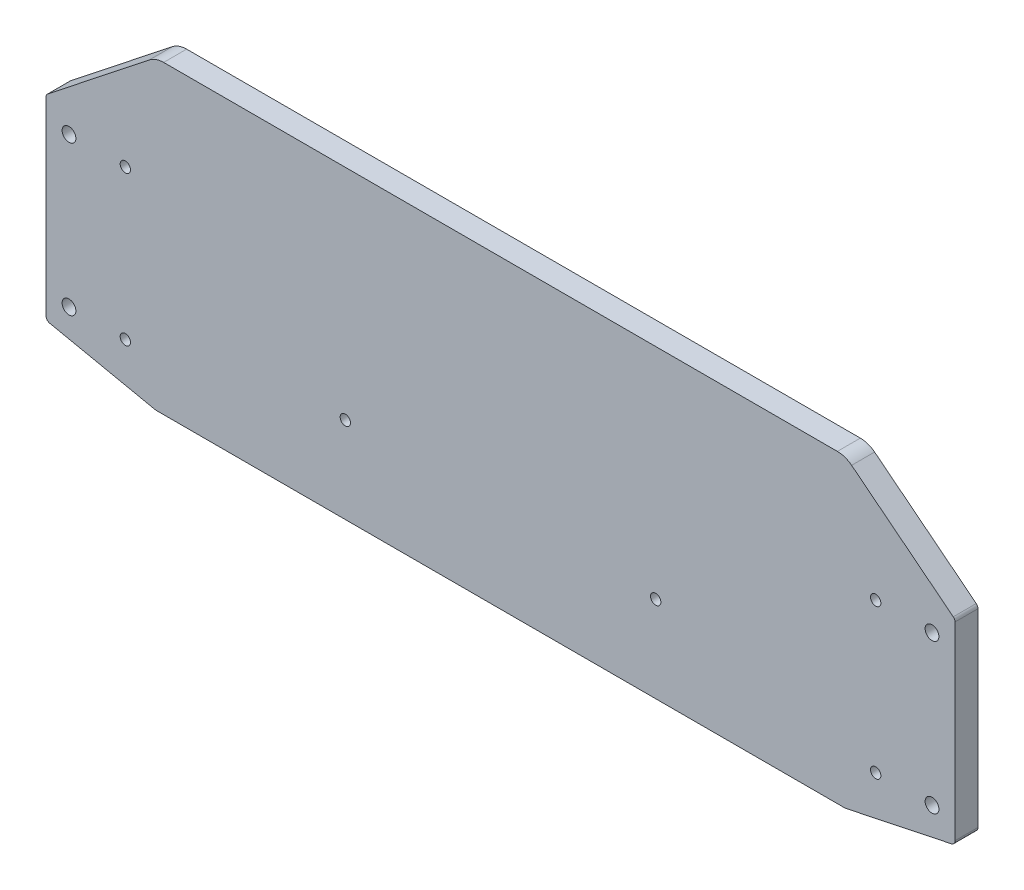
from build123d import *

# Parameters (mm, degrees)
BOSS_EXTRU_1_DEPTH      = 10
ESQUISSE3_R             = 2.25
ESQUISSE3_R_2           = 3
ENL_V_MAT_EXTRU_1_DEPTH = 10
ESQUISSE4_R             = 2.25
ENL_V_MAT_EXTRU_2_DEPTH = 10
CONG_1_R                = 10
CONG_2_R                = 2


with BuildPart() as part:
    # Esquisse1 → Boss.-Extru.1 (new body)
    with BuildSketch(Plane.XY):
        Polygon((-150, 80.2), (-197.7, 42.5), (-197.7, -42.5), (-150, -52.5), (150, -52.5), (197.7, -42.5), (197.7, 42.5), (150, 80.2), align=None)
    extrude(amount=BOSS_EXTRU_1_DEPTH)

    # Esquisse3 → Enlèv. mat.-Extru.1 (cut)
    with BuildSketch(Plane.XY.offset(10)):
        with Locations((-163.2, 32.5)):
            Circle(ESQUISSE3_R)
        with Locations((-187.7, 32.5)):
            Circle(ESQUISSE3_R_2)
        with Locations((-187.7, 57)):
            Circle(ESQUISSE3_R)
        with Locations((-187.7, -32.5)):
            Circle(ESQUISSE3_R_2)
        with Locations((-163.2, -32.5)):
            Circle(ESQUISSE3_R)
        with Locations((187.7, -32.5)):
            Circle(ESQUISSE3_R_2)
        with Locations((163.2, -32.5)):
            Circle(ESQUISSE3_R)
        with Locations((187.7, 32.5)):
            Circle(ESQUISSE3_R_2)
        with Locations((163.2, 32.5)):
            Circle(ESQUISSE3_R)
    extrude(amount=-ENL_V_MAT_EXTRU_1_DEPTH, mode=Mode.SUBTRACT)

    # Esquisse4 → Enlèv. mat.-Extru.2 (cut)
    with BuildSketch(Plane.XY.offset(10)):
        with Locations((-67.5, -15)):
            Circle(ESQUISSE4_R)
        with Locations((67.5, -15)):
            Circle(ESQUISSE4_R)
    extrude(amount=-ENL_V_MAT_EXTRU_2_DEPTH, mode=Mode.SUBTRACT)

    # Congé1
    cong_1_edges = [part.edges().sort_by_distance(p)[0] for p in [
        (-150, 80.2, 5),
        (150, 80.2, 5),
        (150, -52.5, 5),
        (-150, -52.5, 5),
    ]]
    fillet(cong_1_edges, radius=CONG_1_R)

    # Congé2
    cong_2_edges = [part.edges().sort_by_distance(p)[0] for p in [
        (-197.7, -42.5, 5),
        (-197.7, 42.5, 5),
        (197.7, -42.5, 5),
        (197.7, 42.5, 5),
    ]]
    fillet(cong_2_edges, radius=CONG_2_R)


solid = part.part
